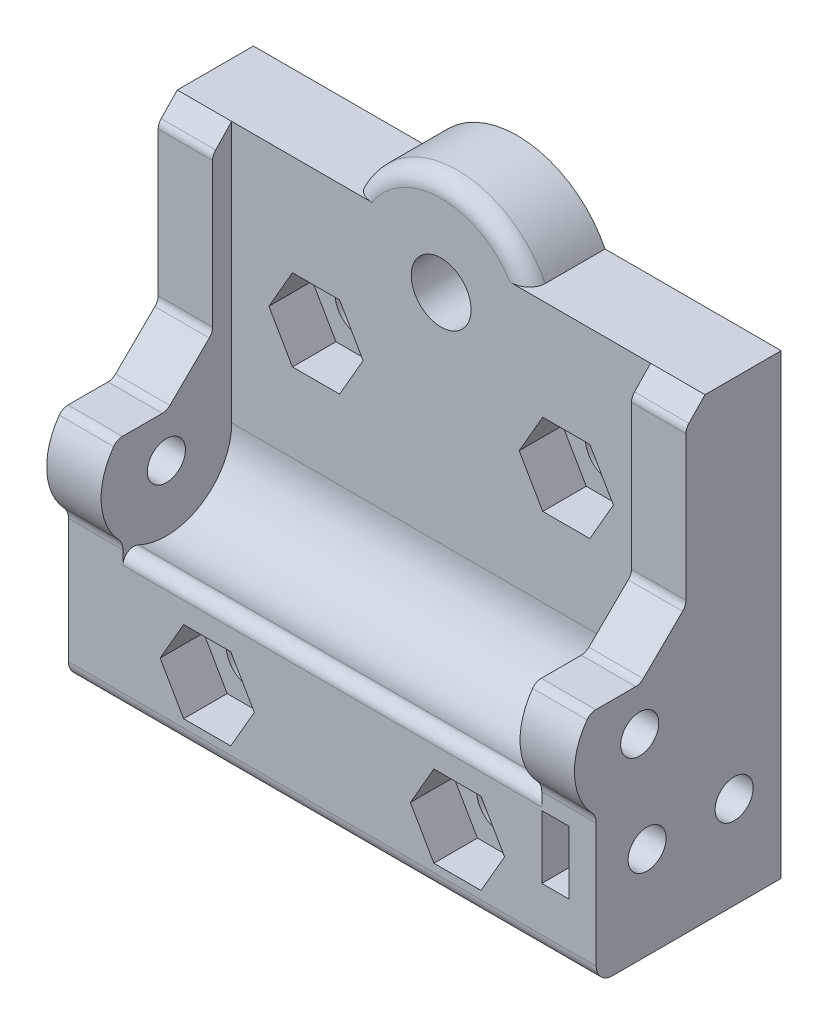
from build123d import *

# Parameters (mm, degrees)
BOSS_EXTRUDE1_DEPTH = 24.25
BOSS_EXTRUDE2_DEPTH = 7
SKETCH2_R           = 2.25
SKETCH2_R_2         = 2.75
CUT_EXTRUDE1_DEPTH  = 30
RIB2_START          = -5
RIB2_DEPTH          = 5
SKETCH11_R          = 1.75
CUT_EXTRUDE3_DEPTH  = 59.320283327
CUT_EXTRUDE5_DEPTH  = 4
CUT_EXTRUDE6_DEPTH  = 2.5
FILLET1_R           = 1
CUT_EXTRUDE7_DEPTH  = 4
FILLET2_R           = 1.5
SKETCH16_R          = 1.75
CUT_EXTRUDE8_DEPTH  = 5
CUT_EXTRUDE11_DEPTH = 2.5


# Read off the part's stored shape, not the designer's step: Rib2
with BuildPart() as part:
    # Sketch1 → Boss-Extrude1 (new, symmetric)
    with BuildSketch(Plane(origin=(0, 0, 0), x_dir=(0, 0, -1), z_dir=(1, 0, 0))):
        with BuildLine():
            Line((-2.5, 13.03872504), (4.5, 13.03872504))
            Line((4.5, 13.03872504), (4.5, -28.96127496))
            Line((4.5, -28.96127496), (-12.5, -28.96127496))
            Line((-12.5, -28.96127496), (-12.5, -15.433410915))
            ThreePointArc((-12.5, -15.433410915), (-6.050510257, -16.438500535), (-2.5, -10.96127496))
            Line((-2.5, -10.96127496), (-2.5, 13.03872504))
        make_face()
    extrude(amount=BOSS_EXTRUDE1_DEPTH, both=True)

    # Sketch8 → Boss-Extrude2 (add)
    with BuildSketch(Plane(origin=(0, 0, -4.5), x_dir=(-1, 0, 0), z_dir=(0, 0, -1))):
        with BuildLine():
            Line((-8.062257748, 13.03872504), (8.062257748, 13.03872504))
            ThreePointArc((8.062257748, 13.03872504), (0, 18.03872504), (-8.062257748, 13.03872504))
        make_face()
    extrude(amount=-BOSS_EXTRUDE2_DEPTH)

    # Sketch2 → Cut-Extrude1 (cut)
    with BuildSketch(Plane(origin=(0, 0, -4.5), x_dir=(-1, 0, 0), z_dir=(0, 0, -1))):
        with Locations(Location((11.5, 0.03872504, 0), (0, 0, 90))):
            Circle(SKETCH2_R)
        with Locations(Location((-11.5, 0.03872504, 0), (0, 0, 90))):
            Circle(SKETCH2_R)
        with Locations(Location((-11.5, -22.96127496, 0), (0, 0, 90))):
            Circle(SKETCH2_R)
        with Locations(Location((11.5, -22.96127496, 0), (0, 0, 90))):
            Circle(SKETCH2_R)
        with Locations(Location((0, 9.03872504, 0), (0, 0, 90))):
            Circle(SKETCH2_R_2)
    extrude(amount=-CUT_EXTRUDE1_DEPTH, mode=Mode.SUBTRACT)

    # Rib2 outline → Rib2 (add)
    with BuildSketch(Plane(origin=(24.25, 0, 0), x_dir=(0, 0, -1), z_dir=(1, 0, 0)).offset(RIB2_START)):
        with BuildLine():
            Line((-2.5, 13.03872504), (-4.258517887, 11.208482718))
            Line((-4.258517887, 11.208482718), (-4.258517887, -2.878129508))
            Line((-4.258517887, -2.878129508), (-8.467587637, -7.01127496))
            Line((-8.467587637, -7.01127496), (-13.016359153, -7.01127496))
            ThreePointArc((-13.016359153, -7.01127496), (-14.488755031, -11.328444107), (-12.5, -15.433410915))
            ThreePointArc((-12.5, -15.433410915), (-6.050510257, -16.438500535), (-2.5, -10.96127496))
            Line((-2.5, -10.96127496), (-2.5, 13.03872504))
        make_face()
    rib2 = extrude(amount=RIB2_DEPTH)

    # Mirror1: Rib2 across plane
    add(rib2.mirror(Plane(origin=(0, 0, 0), x_dir=(0, 0, 1), z_dir=(1, 0, 0))))

    # Sketch11 → Cut-Extrude3 (cut, through all)
    with BuildSketch(Plane(origin=(24.25, 0, 0), x_dir=(0, 0, -1), z_dir=(1, 0, 0))):
        with Locations((-8.5, -10.96127496)):
            Circle(SKETCH11_R)
    extrude(amount=-CUT_EXTRUDE3_DEPTH, mode=Mode.SUBTRACT)

    # Sketch12 → Cut-Extrude5 (cut)
    with BuildSketch(Plane(origin=(0, 0, -1.5), x_dir=(-1, 0, 0), z_dir=(0, 0, -1))):
        Polygon((15.830127019, 0.03872504), (13.665063509, 3.78872504), (9.334936491, 3.78872504), (7.169872981, 0.03872504), (9.334936491, -3.71127496), (13.665063509, -3.71127496), align=None)
        Polygon((-7.169872981, 0.03872504), (-9.334936491, 3.78872504), (-13.665063509, 3.78872504), (-15.830127019, 0.03872504), (-13.665063509, -3.71127496), (-9.334936491, -3.71127496), align=None)
    extrude(amount=-CUT_EXTRUDE5_DEPTH, mode=Mode.SUBTRACT)

    # Sketch14 → Cut-Extrude6 (cut)
    with BuildSketch(Plane(origin=(0, 0, -4.5), x_dir=(-1, 0, 0), z_dir=(0, 0, -1))):
        Polygon((0, 13.946202328), (-4.25, 11.492463684), (-4.25, 6.584986396), (0, 4.131247752), (4.25, 6.584986396), (4.25, 11.492463684), align=None)
    extrude(amount=-CUT_EXTRUDE6_DEPTH, mode=Mode.SUBTRACT)

    # Fillet1
    fillet1_edges = [part.edges().sort_by_distance(p)[0] for p in [
        (0, -15.433410915, 12.5),
        (21.75, -2.878129508, 4.258517887),
        (21.75, -7.01127496, 8.467587637),
        (21.75, -7.01127496, 13.016359153),
        (21.75, 11.208482718, 4.258517887),
        (-21.75, -7.01127496, 13.016359153),
        (-21.75, -7.01127496, 8.467587637),
        (-21.75, -2.878129508, 4.258517887),
        (-21.75, 11.208482718, 4.258517887),
    ]]
    fillet(fillet1_edges, radius=FILLET1_R)

    # Sketch15 → Cut-Extrude7 (cut)
    with BuildSketch(Plane.XY.offset(12.5)):
        Polygon((-7.169872981, -22.96127496), (-9.334936491, -19.21127496), (-13.665063509, -19.21127496), (-15.830127019, -22.96127496), (-13.665063509, -26.71127496), (-9.334936491, -26.71127496), align=None)
        Polygon((15.830127019, -22.96127496), (13.665063509, -19.21127496), (9.334936491, -19.21127496), (7.169872981, -22.96127496), (9.334936491, -26.71127496), (13.665063509, -26.71127496), align=None)
    extrude(amount=-CUT_EXTRUDE7_DEPTH, mode=Mode.SUBTRACT)

    # Fillet2
    fillet2_edges = [part.edges().sort_by_distance(p)[0] for p in [
        (0, -28.96127496, 12.5),
        (21.75, -15.433410915, 12.5),
        (0, 18.03872504, 2.5),
        (-21.75, -15.433410915, 12.5),
    ]]
    fillet(fillet2_edges, radius=FILLET2_R)

    # Sketch16 → Cut-Extrude8 (cut)
    with BuildSketch(Plane(origin=(24.25, 0, 0), x_dir=(0, 0, -1), z_dir=(1, 0, 0))):
        with Locations((0.178756589, -20.46127496)):
            Circle(SKETCH16_R)
        with Locations((-7.821243411, -20.46127496)):
            Circle(SKETCH16_R)
    extrude(amount=-CUT_EXTRUDE8_DEPTH, mode=Mode.SUBTRACT)

    # Sketch18 → Cut-Extrude11 (cut)
    with BuildSketch(Plane(origin=(19.25, 0, 0), x_dir=(0, 0, -1), z_dir=(1, 0, 0))):
        Polygon((-6.146927631, -17.56127496), (-12.752223074, -17.56127496), (-12.752223074, -23.36127496), (-6.146927631, -23.36127496), (-4.47261185, -20.46127496), align=None)
        Polygon((-1.495559192, -23.36127496), (4.713363878, -23.36127496), (4.713363878, -17.56127496), (-1.495559192, -17.56127496), (-3.169874973, -20.46127496), align=None)
    extrude(amount=CUT_EXTRUDE11_DEPTH, mode=Mode.SUBTRACT)


solid = part.part
